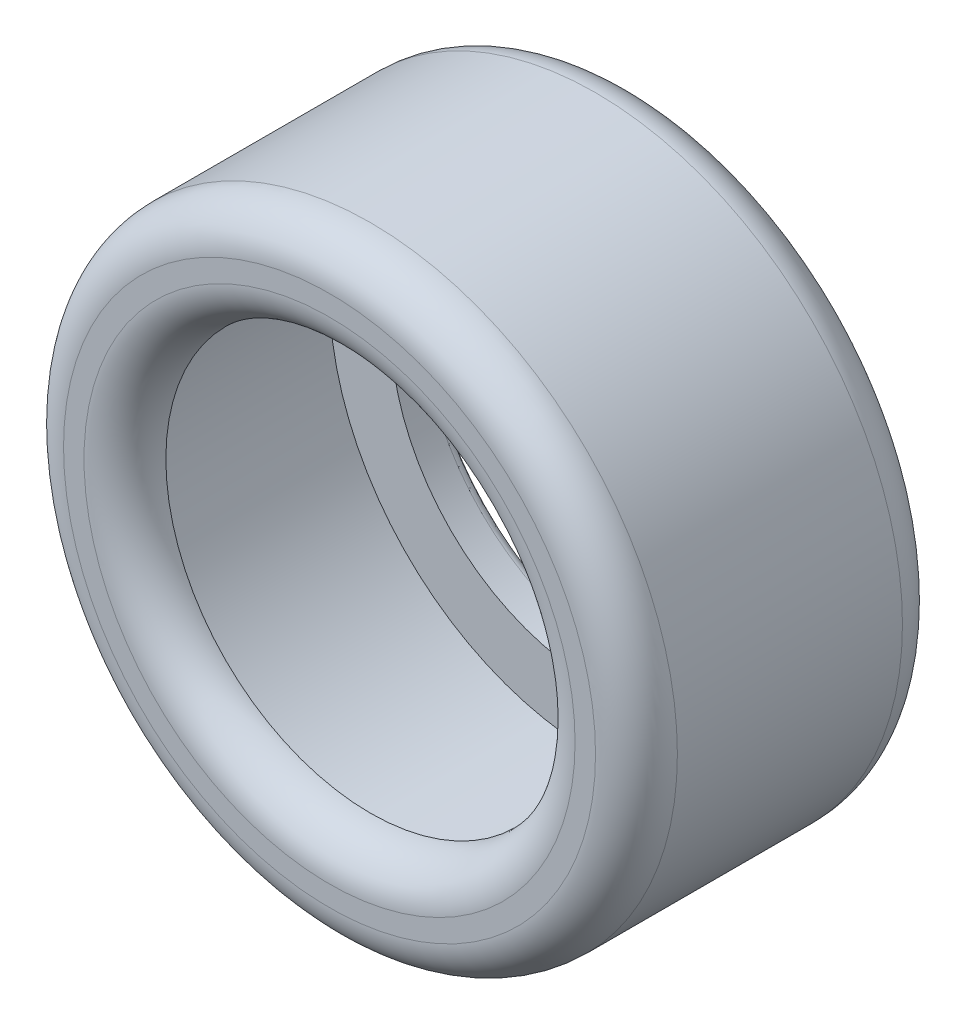
from build123d import *

# Parameters (mm, degrees)
SKETCH1_R           = 15
SKETCH1_R_2         = 10
EXTRUDE_THIN1_DEPTH = 15
FILLET1_R           = 2
FILLET2_R           = 0.5
SHELL5_START        = 2
SHELL5_OUTLINE_R    = 13
SHELL5_OUTLINE_R_2  = 10
SHELL5_DEPTH        = 11


# Read off the part's stored shape, not the designer's step: Shell5
with BuildPart() as part:
    # Sketch1 → Extrude-Thin1 (new body)
    with BuildSketch(Plane.XY):
        Circle(SKETCH1_R)
        Circle(SKETCH1_R_2, mode=Mode.SUBTRACT)
    extrude(amount=EXTRUDE_THIN1_DEPTH)

    # Fillet1
    fillet1_edges = [part.edges().sort_by_distance(p)[0] for p in [
        (-15, 0, 0),
        (-15, 0, 15),
        (-10, 0, 15),
    ]]
    fillet(fillet1_edges, radius=FILLET1_R)

    # Fillet2
    fillet2_edges = [part.edges().sort_by_distance(p)[0] for p in [
        (-10, 0, 0),
    ]]
    fillet(fillet2_edges, radius=FILLET2_R)

    # Shell5 outline → Shell5 (cut)
    with BuildSketch(Plane.XY.offset(SHELL5_START)):
        Circle(SHELL5_OUTLINE_R)
        Circle(SHELL5_OUTLINE_R_2, mode=Mode.SUBTRACT)
    extrude(amount=SHELL5_DEPTH, mode=Mode.SUBTRACT)


solid = part.part
